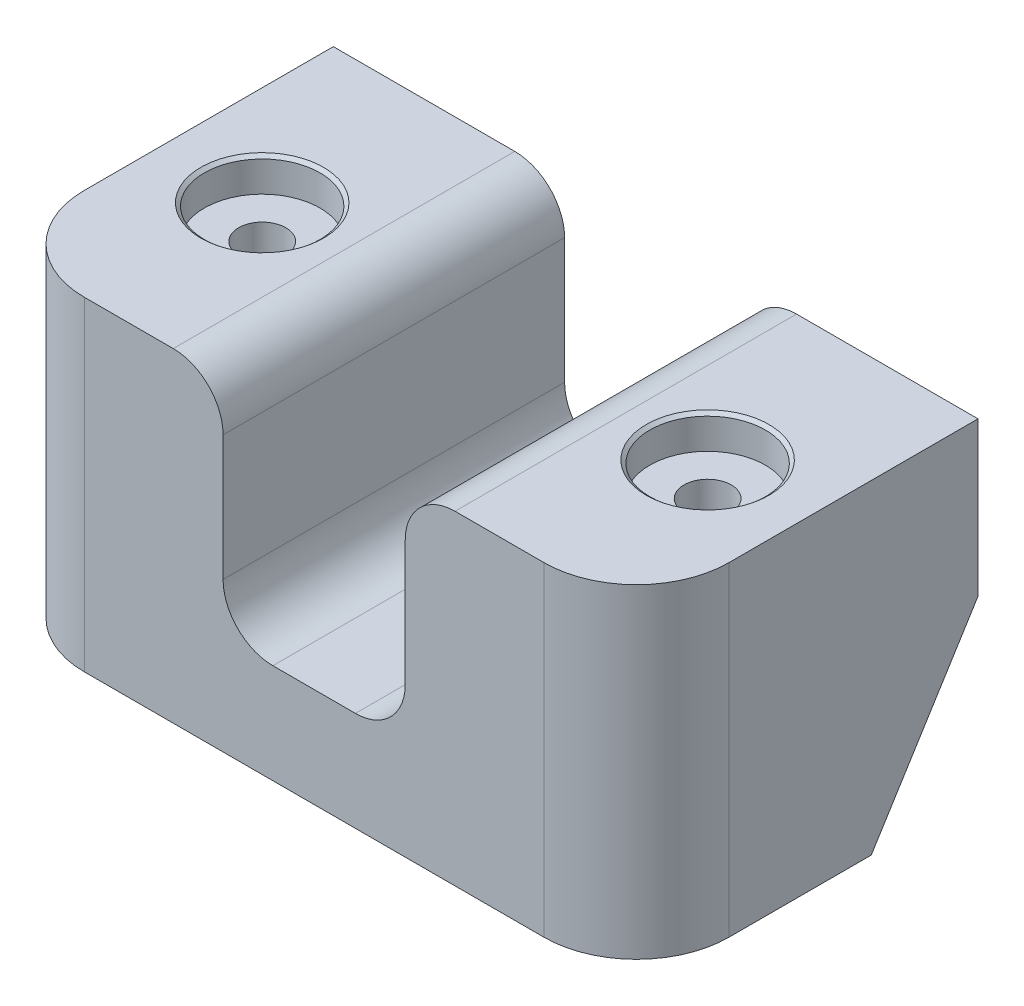
from build123d import *

# Parameters (mm, degrees)
SKETCH1_W                                = 115.062
SKETCH1_H                                = 60.96
BOSS_EXTRUDE1_DEPTH                      = 57.912
SKETCH3_W                                = 32.512
SKETCH3_H                                = 40.132
CUT_EXTRUDE1_DEPTH                       = 79.502
FILLET1_R                                = 16.51
FILLET2_R                                = 8.89
CBORE_FOR_5_16_HEX_HEAD_BOLT1_AT_2_COUNT = 2
CBORE_FOR_5_16_HEX_HEAD_BOLT1_AT_2_PITCH = 79.502
MIRROR1_START                            = -43.619425251
MIRROR1_OUTLINE_W                        = 33
MIRROR1_OUTLINE_H                        = 39
MIRROR1_DEPTH                            = 13.631070391
SHELL1_T                                 = -2.54


# Read off the part's stored shape, not the designer's step: Mirror1
with BuildPart() as part:
    # Sketch1 → Boss-Extrude1 (new body)
    with BuildSketch(Plane(origin=(0, 0, 0), x_dir=(1, 0, 0), z_dir=(0, 1, 0))):
        with Locations((57.531, 30.48)):
            Rectangle(SKETCH1_W, SKETCH1_H)
    extrude(amount=BOSS_EXTRUDE1_DEPTH)

    # Sketch3 → Cut-Extrude1 (cut)
    with BuildSketch(Plane(origin=(0, 0, -60.96), x_dir=(-1, 0, 0), z_dir=(0, 0, -1))):
        with Locations((-57.531, 37.846)):
            Rectangle(SKETCH3_W, SKETCH3_H)
    extrude(amount=-CUT_EXTRUDE1_DEPTH, mode=Mode.SUBTRACT)

    # Fillet1
    fillet1_edges = [part.edges().sort_by_distance(p)[0] for p in [
        (115.062, 28.956, 0),
        (0, 28.956, 0),
    ]]
    fillet(fillet1_edges, radius=FILLET1_R)

    # Fillet2
    fillet2_edges = [part.edges().sort_by_distance(p)[0] for p in [
        (73.787, 57.912, -30.48),
        (41.275, 57.912, -30.48),
        (41.275, 17.78, -30.48),
        (73.787, 17.78, -30.48),
    ]]
    fillet(fillet2_edges, radius=FILLET2_R)

    # Sketch5 → CBORE for 5/16 Hex Head Bolt1 (revolve, cut)
    with BuildSketch(Plane(origin=(17.78, 57.912, -30.48), x_dir=(0, 0, 1), z_dir=(1, 0, 0))):
        Polygon((0, 0), (0, 57.912), (4.2164, 57.912), (4.2164, 5.969), (10.31875, 5.969), (10.31875, 0.532828266), (10.95375, 0), align=None)
    cbore_for_5_16_hex_head_bolt1 = revolve(axis=Axis((17.78, 64.262, -30.48), (0, -1, 0)), mode=Mode.SUBTRACT)

    # CBORE for 5/16 Hex Head Bolt1 at 2: CBORE for 5/16 Hex Head Bolt1 ×2
    with Locations(*[(i * CBORE_FOR_5_16_HEX_HEAD_BOLT1_AT_2_PITCH, 0, 0) for i in range(1, CBORE_FOR_5_16_HEX_HEAD_BOLT1_AT_2_COUNT)]):
        add(cbore_for_5_16_hex_head_bolt1, mode=Mode.SUBTRACT)

    # SurfaceCut1
    split(bisect_by=Plane(origin=(49.231296, -41.02608, -65.641728), x_dir=(0.8438009243891594, 0.2844272778839867, 0.45508364461437806), z_dir=(-0.5366563145999497, 0.44721359549995837, 0.7155417527999325)), keep=Keep.TOP)

    # Mirror1 outline → Mirror1 (cut)
    with BuildSketch(Plane(origin=(0, 0, 0), x_dir=(0.8438009243891591, -0.284427277883987, -0.4550836446143786), z_dir=(0.5366563145999501, 0.4472135954999582, 0.7155417527999323)).offset(MIRROR1_START)):
        with Locations((34.5, 40.5)):
            Rectangle(MIRROR1_OUTLINE_W, MIRROR1_OUTLINE_H)
    extrude(amount=MIRROR1_DEPTH, mode=Mode.SUBTRACT)

    # Shell1
    shell1_openings = [part.faces().sort_by_distance(p)[0] for p in [
        (57.531, 0, -29.124585382),
    ]]
    offset(amount=SHELL1_T, openings=shell1_openings, kind=Kind.INTERSECTION)


solid = part.part
